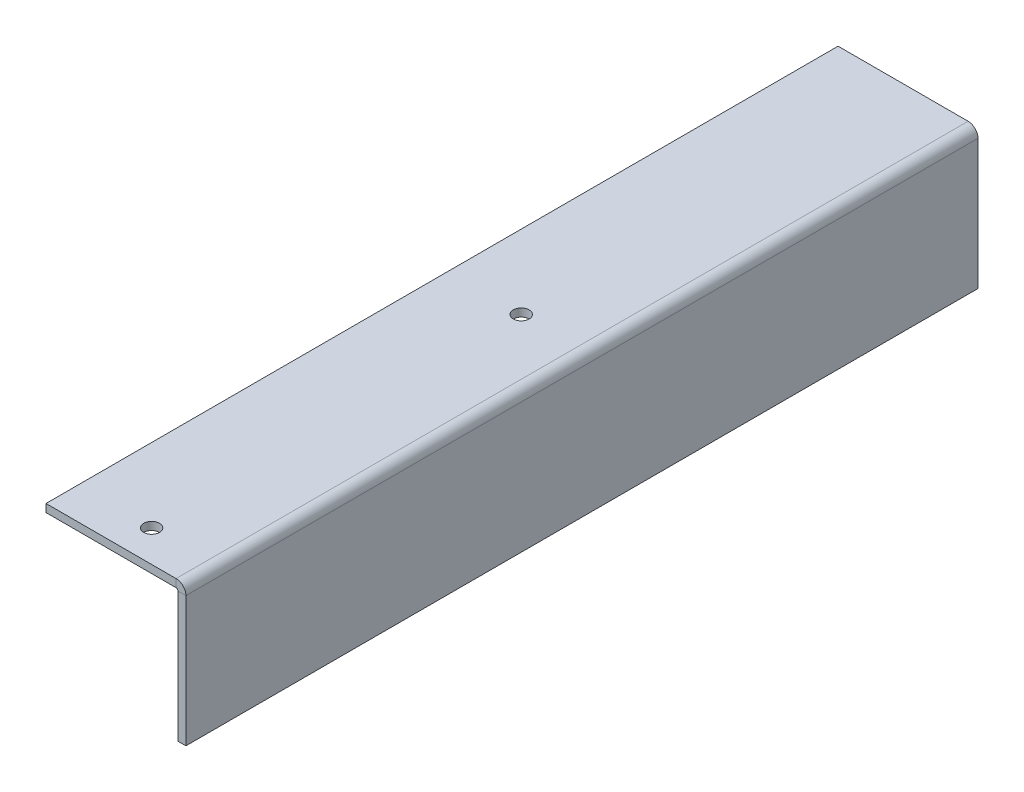
from build123d import *

# Parameters (mm, degrees)
BASE_FLANGE1_DEPTH = 300
SKETCH6_R          = 3
CUT_EXTRUDE1_DEPTH = 10


# Sheet-metal steps are written as plain solids
with BuildPart() as part:
    # Sketch1 → Base-Flange1 (new body)
    with BuildSketch(Plane.XY):
        with BuildLine():
            Line((0, 0), (0, 49.2634))
            ThreePointArc((0, 49.2634), (-0.215745145, 49.784254855), (-0.7366, 50))
            Line((-0.7366, 50), (-50, 50))
            Line((-50, 50), (-50, 53))
            Line((-50, 53), (-0.7366, 53))
            ThreePointArc((-0.7366, 53), (1.905575199, 51.905575199), (3, 49.2634))
            Line((3, 49.2634), (3, 0))
            Line((3, 0), (0, 0))
        make_face()
    extrude(amount=BASE_FLANGE1_DEPTH)

    # Sketch6 → Cut-Extrude1 (cut)
    with BuildSketch(Plane(origin=(0, 53, 0), x_dir=(1, 0, 0), z_dir=(0, 1, 0))):
        with Locations(Location((-22, -288, 0), (0, 0, 180))):
            Circle(SKETCH6_R)
        with Locations(Location((-22, -148, 0), (0, 0, 180))):
            Circle(SKETCH6_R)
    extrude(amount=-CUT_EXTRUDE1_DEPTH, mode=Mode.SUBTRACT)


solid = part.part
